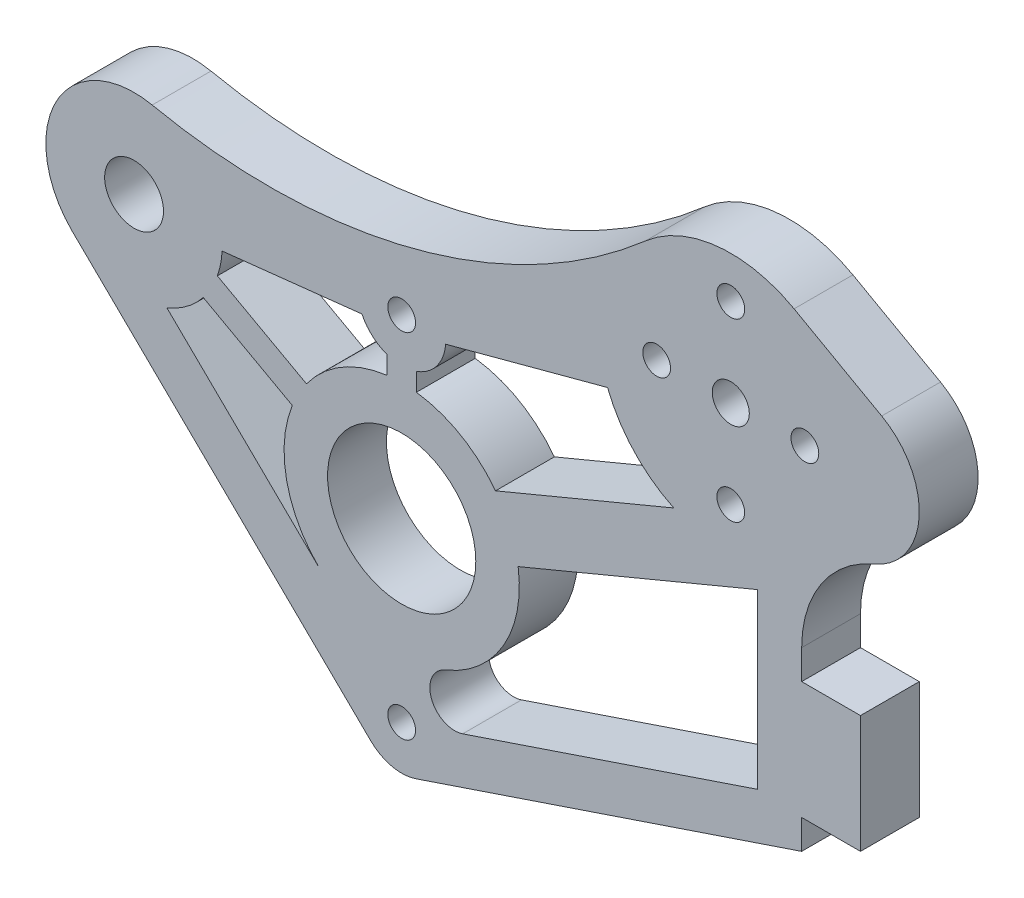
from build123d import *

# Parameters (mm, degrees)
SKETCH1_R           = 1.5
SKETCH1_R_2         = 8.000000002
SKETCH1_R_3         = 3.175
SKETCH1_R_4         = 2
BOSS_EXTRUDE1_DEPTH = 3.175
CUT_EXTRUDE1_DEPTH  = 71.537419325


with BuildPart() as part:
    # Sketch1 → Boss-Extrude1 (new, symmetric)
    with BuildSketch(Plane.XY):
        with BuildLine():
            Line((49.53, 6.35), (43.18, 6.35))
            Line((43.18, 6.35), (43.18, 9.525))
            ThreePointArc((43.18, 9.525), (45.312961262, 16.569692492), (50.995384615, 21.248076923))
            ThreePointArc((50.995384615, 21.248076923), (55.86680647, 28.117536095), (51.818248704, 35.501938591))
            Line((51.818248704, 35.501938591), (42.362518376, 40.792592475))
            ThreePointArc((42.362518376, 40.792592475), (34.074140371, 42.499456901), (26.316415805, 39.118879189))
            ThreePointArc((26.316415805, 39.118879189), (1.327154217, 25.89128793), (-26.938565856, 25.1974335))
            ThreePointArc((-26.938565856, 25.1974335), (-37.294510879, 20.3618517), (-35.553083778, 9.066017056))
            Line((-35.553083778, 9.066017056), (-3.330291889, -22.454491472))
            ThreePointArc((-3.330291889, -22.454491472), (-1.061048588, -23.692798956), (1.520823054, -23.563147847))
            Line((1.520823054, -23.563147847), (43.18, -9.525))
            Line((43.18, -9.525), (43.18, -6.35))
            Line((43.18, -6.35), (49.53, -6.35))
            Line((49.53, -6.35), (49.53, 6.35))
        make_face()
        with Locations((0, -19.05)):
            Circle(SKETCH1_R, mode=Mode.SUBTRACT)
        Circle(SKETCH1_R_2, mode=Mode.SUBTRACT)
        with Locations((-28.8925, 15.875)):
            Circle(SKETCH1_R_3, mode=Mode.SUBTRACT)
        with Locations((0, 19.05)):
            Circle(SKETCH1_R, mode=Mode.SUBTRACT)
        with Locations((35.526552159, 19.075)):
            Circle(SKETCH1_R, mode=Mode.SUBTRACT)
        with Locations((27.526552159, 28.575)):
            Circle(SKETCH1_R, mode=Mode.SUBTRACT)
        with Locations((35.526552159, 28.575)):
            Circle(SKETCH1_R_4, mode=Mode.SUBTRACT)
        with Locations((43.526552159, 28.575)):
            Circle(SKETCH1_R, mode=Mode.SUBTRACT)
        with Locations((35.526552159, 38.075)):
            Circle(SKETCH1_R, mode=Mode.SUBTRACT)
    extrude(amount=BOSS_EXTRUDE1_DEPTH, both=True)

    # Sketch2 → Cut-Extrude1 (cut, through all)
    with BuildSketch(Plane.XY.offset(3.175)):
        with BuildLine():
            ThreePointArc((-1.5875, 14.559871939), (-3.178353219, 15.503244149), (-4.289853455, 16.981531101))
            Line((-4.289853455, 16.981531101), (-19.383514975, 15.322886978))
            ThreePointArc((-19.383514975, 15.322886978), (-19.550772303, 14.015497744), (-19.89690785, 12.74371482))
            Line((-19.89690785, 12.74371482), (-10.278764881, 7.459020882))
            ThreePointArc((-10.278764881, 7.459020882), (-6.466102478, 10.930668724), (-1.5875, 12.600390619))
            Line((-1.5875, 12.600390619), (-1.5875, 14.559871939))
        make_face()
        with BuildLine():
            ThreePointArc((-8.880778371, -9.078643925), (-12.421889853, -2.643227662), (-11.807682942, 4.676390011))
            Line((-11.807682942, 4.676390011), (-21.425825911, 9.96108395))
            ThreePointArc((-21.425825911, 9.96108395), (-23.197088194, 8.240348118), (-25.351178817, 7.032790475))
            Line((-25.351178817, 7.032790475), (-8.880778371, -9.078643925))
        make_face()
        with BuildLine():
            Line((38.4175, -6.104219876), (38.4175, 12.567708333))
            Line((38.4175, 12.567708333), (12.571974269, 1.798739279))
            ThreePointArc((12.571974269, 1.798739279), (10.997973119, -6.350951682), (4.726193285, -11.787836826))
            ThreePointArc((4.726193285, -11.787836826), (3.204136728, -15.213097846), (6.585209069, -16.830941793))
            Line((6.585209069, -16.830941793), (38.4175, -6.104219876))
        make_face()
        with BuildLine():
            Line((10.129666576, 7.66027774), (29.375496987, 15.679373744))
            ThreePointArc((29.375496987, 15.679373744), (25.067763274, 18.8412242), (22.222994298, 23.364625301))
            Line((22.222994298, 23.364625301), (4.748061308, 18.679432773))
            ThreePointArc((4.748061308, 18.679432773), (3.778561848, 16.151055948), (1.5875, 14.559871939))
            Line((1.5875, 14.559871939), (1.5875, 12.600390619))
            ThreePointArc((1.5875, 12.600390619), (6.358001019, 10.993899356), (10.129666576, 7.66027774))
        make_face()
    extrude(amount=-CUT_EXTRUDE1_DEPTH, mode=Mode.SUBTRACT)


solid = part.part
